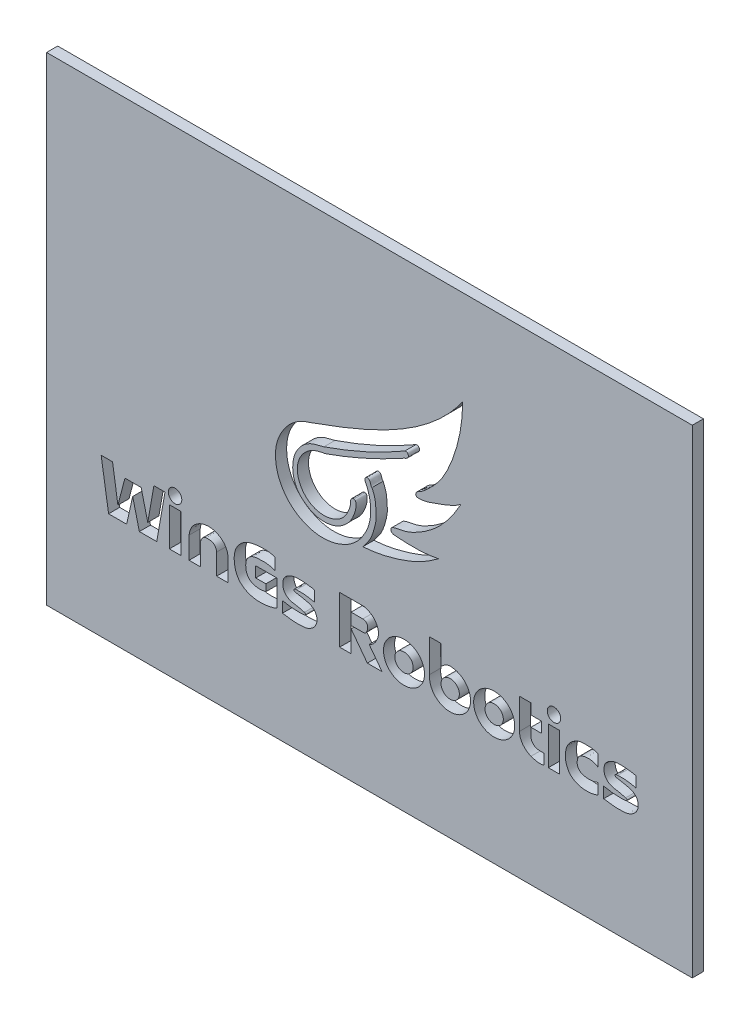
from build123d import *

# Parameters (mm, degrees)
SKETCH1_W           = 116
SKETCH1_H           = 86
BOSS_EXTRUDE1_DEPTH = 2
SKETCH2_W           = 2.050080953
SKETCH2_H           = 6.874434124
SKETCH2_W_2         = 1.981029746
SKETCH2_H_2         = 6.809423223
SKETCH2_R           = 1.213859124
SKETCH2_R_2         = 1.204225855
CUT_EXTRUDE1_DEPTH  = 11


with BuildPart() as part:
    # Sketch1 → Boss-Extrude1 (new body)
    with BuildSketch(Plane.XY):
        with Locations((58, 43)):
            Rectangle(SKETCH1_W, SKETCH1_H)
    extrude(amount=BOSS_EXTRUDE1_DEPTH)

    # Sketch2 → Cut-Extrude1 (cut)
    # profile 1 of 16: a face of its own
    with BuildSketch(Plane.XY.offset(2)):
        Polygon((11.852733183, 28.23498876), (9.80265223, 28.23498876), (11.140293702, 19.790279863), (14.382620316, 19.790279863), (15.467765439, 24.653578889), (16.665334568, 19.790279863), (19.785291617, 19.790279863), (21.274381817, 28.23498876), (19.282459189, 28.23498876), (18.177451016, 21.968429251), (16.985205355, 26.810109799), (14.07728911, 26.810109799), (12.812345543, 21.968429251), align=None)
    # profile 2 of 16: a face of its own
    with BuildSketch(Plane.XY.offset(2)):
        with Locations((23.08455968, 23.227496925)):
            Rectangle(SKETCH2_W, SKETCH2_H)
    # profile 3 of 16: a face of its own
    with BuildSketch(Plane.XY.offset(2)):
        with BuildLine():
            Line((32.593329118, 19.790279863), (32.593329118, 23.698574699))
            add(Edge.make_bspline(
                [(25.597182949, 23.698574699), (25.655024383, 24.365774688), (26.094095564, 25.511687071), (27.542408981, 26.573688518), (30.276837479, 27.206654041), (32.573603491, 25.561936036), (32.593329118, 23.698574699)],
                knots=[0, 0, 0, 0, 0.198571456, 0.340640158, 0.513500481, 1, 1, 1, 1], degree=3))
            Line((25.597182949, 23.698574699), (25.597182949, 19.790279863))
            Line((25.597182949, 19.790279863), (27.642687936, 19.790279863))
            Line((27.642687936, 19.790279863), (27.642687936, 23.53425261))
            add(Edge.make_bspline(
                [(30.550507488, 23.53425261), (30.543410322, 23.975896739), (30.106824896, 24.716492763), (29.076011424, 24.858477486), (28.007386667, 24.772266409), (27.672864704, 23.933055449), (27.642687936, 23.53425261)],
                knots=[0, 0, 0, 0, 0.311205264, 0.495487823, 0.702071237, 1, 1, 1, 1], degree=3))
            Line((30.550507488, 23.53425261), (30.550507488, 19.790279863))
            Line((30.550507488, 19.790279863), (32.593329118, 19.790279863))
        make_face()
    # profile 4 of 16: a face of its own
    with BuildSketch(Plane.XY.offset(2)):
        with BuildLine():
            add(Edge.make_bspline(
                [(41.058476828, 28.008964275), (40.053420622, 28.339513511), (38.252788176, 28.348289283), (35.579957653, 27.861823316), (33.807127389, 26.011782786), (33.590864529, 23.48949894), (34.259884703, 21.082821932), (36.595364, 19.679501372), (39.068594523, 19.5440089), (40.723497475, 19.936398387), (41.424471902, 20.231702472)],
                knots=[0, 0, 0, 0, 0.156695014, 0.267521344, 0.399378103, 0.502861963, 0.63762312, 0.747872283, 0.886034629, 1, 1, 1, 1], degree=3))
            Line((41.424471902, 20.231702472), (41.424471902, 24.925589684))
            Line((41.424471902, 24.925589684), (37.575915349, 24.925589684))
            Line((37.575915349, 24.925589684), (37.575915349, 23.026010695))
            Line((37.575915349, 23.026010695), (39.392903947, 23.026010695))
            Line((39.392903947, 23.026010695), (39.392903947, 21.787154833))
            add(Edge.make_bspline(
                [(39.392903947, 21.787154833), (38.709328807, 21.648731932), (37.576908234, 21.542273573), (36.102464246, 22.345223797), (35.704866734, 23.743461009), (35.813146547, 25.200823073), (36.969778747, 26.203973561), (38.234458734, 26.273280017), (39.623410218, 26.318179205), (40.523608068, 26.087789356), (41.058476828, 25.902909309)],
                knots=[0, 0, 0, 0, 0.18146663, 0.284134985, 0.402884015, 0.534993454, 0.639880998, 0.765013074, 0.852735118, 1, 1, 1, 1], degree=3))
            Line((41.058476828, 25.902909309), (41.058476828, 28.008964275))
        make_face()
    # profile 5 of 16: a face of its own
    with BuildSketch(Plane.XY.offset(2)):
        with BuildLine():
            Line((42.372568114, 21.90410986), (42.372568114, 19.942636104))
            add(Edge.make_bspline(
                [(44.806139371, 24.345586206), (45.423564394, 24.273968664), (46.288006885, 24.064813555), (47.46290877, 23.806737598), (48.147012509, 23.319049527), (48.545595153, 22.590177306), (48.619598313, 21.763304801), (48.319682406, 20.806370209), (47.572161935, 20.139557196), (46.608821821, 19.710816999), (45.568962771, 19.681190723), (44.121341532, 19.640413074), (43.061307266, 19.870150262), (42.372568114, 19.942636104)],
                knots=[0, 0, 0, 0, 0.150365809, 0.21715787, 0.290606041, 0.346071454, 0.414260527, 0.486930119, 0.581715223, 0.647372918, 0.740088904, 0.830726665, 1, 1, 1, 1], degree=3))
            add(Edge.make_bspline(
                [(44.51078328, 24.752820598), (44.406308103, 24.717681376), (44.387924492, 24.412408384), (44.702186936, 24.383832223), (44.806139371, 24.345586206)],
                knots=[0, 0, 0, 0, 0.400794389, 1, 1, 1, 1], degree=3))
            add(Edge.make_bspline(
                [(44.888792958, 24.852708279), (44.689182117, 24.848786999), (44.51078328, 24.752820598)],
                knots=[0, 0, 0, 1, 1, 1], degree=2))
            add(Edge.make_bspline(
                [(48.148216766, 24.517425483), (46.54397318, 24.945679792), (44.888792958, 24.852708279)],
                knots=[0, 0, 0, 1, 1, 1], degree=2))
            Line((48.148216766, 24.517425483), (48.148216766, 26.428077311))
            add(Edge.make_bspline(
                [(46.317322138, 22.049037935), (45.824731993, 22.210742689), (44.975778867, 22.40163227), (43.648132153, 22.55699702), (42.701652483, 23.251908996), (42.420499941, 24.163498462), (42.431107022, 24.854255388), (42.572538443, 25.490668332), (43.004076818, 26.004420138), (43.507908782, 26.358764483), (44.109433868, 26.601004045), (44.74426891, 26.734288086), (45.445562789, 26.743327695), (46.262343534, 26.742582693), (47.164011558, 26.592971419), (47.832474332, 26.519558956), (48.148216766, 26.428077311)],
                knots=[0, 0, 0, 0, 0.129354314, 0.216840147, 0.332807427, 0.395281765, 0.447955501, 0.504878839, 0.55358992, 0.611567985, 0.657300196, 0.714661081, 0.77238727, 0.832100329, 0.918345636, 1, 1, 1, 1], degree=3))
            add(Edge.make_bspline(
                [(42.372568114, 21.90410986), (42.852483981, 21.803658023), (43.540520525, 21.684742464), (44.478218307, 21.597026122), (45.194509725, 21.588266366), (45.868754908, 21.582787144), (46.30052186, 21.631307616), (46.529651689, 21.687660928), (46.556676317, 21.797012759), (46.552265055, 21.96425316), (46.37902786, 22.020999474), (46.317322138, 22.049037935)],
                knots=[0, 0, 0, 0, 0.315552381, 0.449832635, 0.605449321, 0.778844328, 0.876434538, 0.897820479, 0.917220083, 0.942476197, 1, 1, 1, 1], degree=3))
        make_face()
    # profile 6 of 16: a face of its own
    with BuildSketch(Plane.XY.offset(2)):
        with BuildLine():
            Line((60.268122243, 19.79950217), (57.950903995, 22.876918969))
            add(Edge.make_bspline(
                [(56.993288194, 28.316464094), (57.507888583, 28.199947411), (58.406020002, 27.861332004), (59.304855599, 26.802490907), (59.764827962, 25.5392533), (59.345117638, 23.970677964), (58.578129601, 23.113462352), (57.950903995, 22.876918969)],
                knots=[0, 0, 0, 0, 0.21664701, 0.372499043, 0.551296922, 0.738033031, 1, 1, 1, 1], degree=3))
            Line((56.993288194, 28.316464094), (52.650010924, 28.316464094))
            Line((52.650010924, 28.316464094), (52.650010924, 19.79950217))
            Line((52.650010924, 19.79950217), (54.699102304, 19.79950217))
            Line((54.699102304, 19.79950217), (54.699102304, 23.683102457))
            Line((54.699102304, 23.683102457), (57.623356652, 19.79950217))
            Line((57.623356652, 19.79950217), (60.268122243, 19.79950217))
        make_face()
        with BuildLine():
            Line((54.699102304, 26.274566068), (56.811430016, 26.274566068))
            add(Edge.make_bspline(
                [(56.811430016, 26.274566068), (57.165142546, 26.312013915), (57.762696052, 25.857331641), (57.662984423, 24.819667856), (57.332468607, 24.193202864), (56.894826652, 24.204529659)],
                knots=[0, 0, 0, 0, 0.345185418, 0.626260613, 1, 1, 1, 1], degree=3))
            Line((56.894826652, 24.204529659), (54.699102304, 24.204529659))
            Line((54.699102304, 24.204529659), (54.699102304, 26.274566068))
        make_face(mode=Mode.SUBTRACT)
    # profile 7 of 16: a face of its own
    with BuildSketch(Plane.XY.offset(2)):
        with BuildLine():
            Line((70.875700117, 29.486042678), (68.793403111, 29.486042678))
            Line((68.793403111, 29.486042678), (68.819382849, 23.63112519))
            add(Edge.make_bspline(
                [(68.819382849, 23.63112519), (68.655909571, 22.307345374), (69.133176794, 19.847694152), (71.555123644, 18.628765547), (73.913456034, 19.661303089), (75.958694453, 21.428786384), (77.249289658, 23.519409778), (76.356923212, 25.969682895), (73.909976939, 26.751395584), (72.510425794, 26.768759222), (72.495262159, 26.76887153), (72.480151116, 26.768908422), (72.46509309, 26.768870944), (72.450088475, 26.768760138)],
                knots=[6.176447512, 6.176447512, 6.176447512, 6.176447512, 6.176447512, 6.176447512, 8.596254133, 8.596254133, 8.596254133, 8.596254133, 10.989752867, 10.989752867, 10.989752867, 10.989752867, 11.016060754, 11.016060754, 11.016060754, 11.016060754, 11.016060754, 11.016060754], degree=5, weights=[1, 1, 0.832613261, 0.832613261, 1, 1, 0.839849545, 0.835296689, 1, 1, 1.000000003, 1.000000003, 1, 1]))
            add(Edge.make_bspline(
                [(70.875700117, 25.957189376), (71.166477188, 26.20926662), (71.655724283, 26.56346003), (72.234921297, 26.761658442), (72.450088475, 26.768760138)],
                knots=[0, 0, 0, 0, 0.616176335, 0.959930277, 0.959930277, 0.959930277, 0.959930277], degree=3))
            Line((70.875700117, 25.957189376), (70.875700117, 29.486042678))
        make_face()
        with BuildLine():
            add(Edge.make_bspline(
                [(70.875700117, 23.037387122), (71.211642535, 20.263073147), (73.493414254, 21.946870158), (75.775185973, 23.630667169), (73.157471836, 24.721184133), (70.539757699, 25.811701097), (70.875700117, 23.037387122)],
                knots=[0, 0, 0, 2.094395102, 2.094395102, 4.188790205, 4.188790205, 6.283185307, 6.283185307, 6.283185307], degree=2, weights=[1, 0.5, 1, 0.5, 1, 0.5, 1]))
        make_face(mode=Mode.SUBTRACT)
    # profile 8 of 16: a face of its own
    with BuildSketch(Plane.XY.offset(2)):
        with BuildLine():
            Line((87.019259344, 28.316464094), (84.974819681, 28.316464094))
            Line((84.974819681, 28.316464094), (84.974819681, 22.876918969))
            add(Edge.make_bspline(
                [(84.974819681, 22.876918969), (84.904874023, 21.581617108), (85.880370875, 20.470748303), (87.019259344, 20.009497646)],
                knots=[0, 0, 0, 0, 1, 1, 1, 1], degree=3))
            add(Edge.make_bspline(
                [(87.019259344, 20.009497646), (87.764844995, 19.766104306), (88.592472755, 19.517741572), (89.369700044, 19.790279863)],
                knots=[0, 0, 0, 0, 1, 1, 1, 1], degree=3))
            Line((89.369700044, 19.790279863), (89.369700044, 21.656437237))
            add(Edge.make_bspline(
                [(89.369700044, 21.656437237), (88.886440556, 21.681452245), (88.103178845, 21.552378339), (87.281716916, 22.165179144), (87.087153612, 22.617862686), (87.019259344, 22.876918969)],
                knots=[0, 0, 0, 0, 0.514659913, 0.724878499, 1, 1, 1, 1], degree=3))
            Line((87.019259344, 22.876918969), (87.019259344, 24.517425483))
            Line((87.019259344, 24.517425483), (88.927403029, 24.517425483))
            Line((88.927403029, 24.517425483), (88.927403029, 26.428077311))
            Line((88.927403029, 26.428077311), (87.019259344, 26.428077311))
            Line((87.019259344, 26.428077311), (87.019259344, 28.316464094))
        make_face()
    # profile 9 of 16: a face of its own
    with BuildSketch(Plane.XY.offset(2)):
        with Locations((91.132775555, 23.194991475)):
            Rectangle(SKETCH2_W_2, SKETCH2_H_2)
    # profile 10 of 16: a face of its own
    with BuildSketch(Plane.XY.offset(2)):
        with BuildLine():
            Line((100.081666186, 21.89670404), (100.081666186, 19.935230284))
            add(Edge.make_bspline(
                [(102.515237443, 24.338180385), (103.132662467, 24.266562843), (103.997104957, 24.057407734), (105.172006842, 23.799331777), (105.856110582, 23.311643706), (106.254693225, 22.582771485), (106.328696385, 21.75589898), (106.028780479, 20.798964389), (105.281260008, 20.132151375), (104.317919893, 19.703411179), (103.278060843, 19.673784902), (101.830439604, 19.633007253), (100.770405338, 19.862744441), (100.081666186, 19.935230284)],
                knots=[0, 0, 0, 0, 0.150365809, 0.21715787, 0.290606041, 0.346071454, 0.414260527, 0.486930119, 0.581715223, 0.647372918, 0.740088904, 0.830726665, 1, 1, 1, 1], degree=3))
            add(Edge.make_bspline(
                [(102.219881352, 24.745414777), (102.115406175, 24.710275556), (102.097022564, 24.405002563), (102.411285008, 24.376426403), (102.515237443, 24.338180385)],
                knots=[0, 0, 0, 0, 0.400794389, 1, 1, 1, 1], degree=3))
            add(Edge.make_bspline(
                [(102.59789103, 24.845302458), (102.398280189, 24.841381178), (102.219881352, 24.745414777)],
                knots=[0, 0, 0, 1, 1, 1], degree=2))
            add(Edge.make_bspline(
                [(105.857314838, 24.510019662), (104.253071252, 24.938273972), (102.59789103, 24.845302458)],
                knots=[0, 0, 0, 1, 1, 1], degree=2))
            Line((105.857314838, 24.510019662), (105.857314838, 26.420671491))
            add(Edge.make_bspline(
                [(104.02642021, 22.041632114), (103.533830066, 22.203336869), (102.68487694, 22.394226449), (101.357230225, 22.5495912), (100.410750556, 23.244503176), (100.129598013, 24.156092641), (100.140205094, 24.846849567), (100.281636516, 25.483262512), (100.71317489, 25.997014317), (101.217006854, 26.351358662), (101.81853194, 26.593598224), (102.453366982, 26.726882265), (103.154660861, 26.735921874), (103.971441607, 26.735176872), (104.87310963, 26.585565598), (105.541572404, 26.512153135), (105.857314838, 26.420671491)],
                knots=[0, 0, 0, 0, 0.129354314, 0.216840147, 0.332807427, 0.395281765, 0.447955501, 0.504878839, 0.55358992, 0.611567985, 0.657300196, 0.714661081, 0.77238727, 0.832100329, 0.918345636, 1, 1, 1, 1], degree=3))
            add(Edge.make_bspline(
                [(100.081666186, 21.89670404), (100.561582053, 21.796252202), (101.249618597, 21.677336643), (102.18731638, 21.589620301), (102.903607798, 21.580860546), (103.57785298, 21.575381323), (104.009619933, 21.623901795), (104.238749761, 21.680255107), (104.265774389, 21.789606938), (104.261363127, 21.95684734), (104.088125932, 22.013593653), (104.02642021, 22.041632114)],
                knots=[0, 0, 0, 0, 0.315552381, 0.449832635, 0.605449321, 0.778844328, 0.876434538, 0.897820479, 0.917220083, 0.942476197, 1, 1, 1, 1], degree=3))
        make_face()
    # profile 11 of 16: a face of its own
    with BuildSketch(Plane.XY.offset(2)):
        with Locations((23.077289889, 28.540319965)):
            Circle(SKETCH2_R)
    # profile 12 of 16: a face of its own
    with BuildSketch(Plane.XY.offset(2)):
        with Locations((91.149003897, 28.540319965)):
            Circle(SKETCH2_R_2)
    # profile 13 of 16: a face of its own
    with BuildSketch(Plane.XY.offset(2)):
        with BuildLine():
            add(Edge.make_bspline(
                [(60.520652519, 23.223770711), (60.520652519, 17.012049197), (66.052713203, 20.117909954), (71.584773886, 23.223770711), (66.052713203, 26.329631468), (60.520652519, 29.435492225), (60.520652519, 23.223770711)],
                knots=[0, 0, 0, 2.094395102, 2.094395102, 4.188790205, 4.188790205, 6.283185307, 6.283185307, 6.283185307], degree=2, weights=[1, 0.5, 1, 0.5, 1, 0.5, 1]))
        make_face()
        with BuildLine():
            add(Edge.make_bspline(
                [(62.575531023, 23.026010695), (62.911473441, 20.251696721), (65.19324516, 21.935493732), (67.475016879, 23.619290743), (64.857302742, 24.709807706), (62.239588605, 25.80032467), (62.575531023, 23.026010695)],
                knots=[0, 0, 0, 2.094395102, 2.094395102, 4.188790205, 4.188790205, 6.283185307, 6.283185307, 6.283185307], degree=2, weights=[1, 0.5, 1, 0.5, 1, 0.5, 1]))
        make_face(mode=Mode.SUBTRACT)
    # profile 14 of 16: a face of its own
    with BuildSketch(Plane.XY.offset(2)):
        with BuildLine():
            add(Edge.make_bspline(
                [(76.723043602, 23.258188157), (76.723043602, 17.046466643), (82.255104285, 20.1523274), (87.787164969, 23.258188157), (82.255104285, 26.364048914), (76.723043602, 29.469909671), (76.723043602, 23.258188157)],
                knots=[0, 0, 0, 2.094395102, 2.094395102, 4.188790205, 4.188790205, 6.283185307, 6.283185307, 6.283185307], degree=2, weights=[1, 0.5, 1, 0.5, 1, 0.5, 1]))
        make_face()
        with BuildLine():
            add(Edge.make_bspline(
                [(78.777922105, 23.060428141), (79.113864523, 20.286114166), (81.395636242, 21.969911177), (83.677407961, 23.653708188), (81.059693824, 24.744225152), (78.441979687, 25.834742116), (78.777922105, 23.060428141)],
                knots=[0, 0, 0, 2.094395102, 2.094395102, 4.188790205, 4.188790205, 6.283185307, 6.283185307, 6.283185307], degree=2, weights=[1, 0.5, 1, 0.5, 1, 0.5, 1]))
        make_face(mode=Mode.SUBTRACT)
    # profile 15 of 16: a face of its own
    with BuildSketch(Plane.XY.offset(2)):
        with BuildLine():
            add(Edge.make_bspline(
                [(47.183080217, 52.026795225), (57.216006345, 55.660419078), (68.349060224, 59.914176828), (74.752380083, 69.037208456)],
                knots=[0, 0, 0, 0, 1, 1, 1, 1], degree=3))
            add(Edge.make_bspline(
                [(58.454232807, 47.516375152), (58.155201107, 47.766256761), (58.242612626, 48.405648514), (57.63435824, 48.725818852), (57.33951575, 48.561080563), (57.148056352, 48.331669293), (57.191833565, 47.968880637), (57.373109598, 47.594828313), (57.64633552, 47.047787141), (57.835821816, 46.438243828), (58.054855682, 45.66789616), (58.183227128, 44.904585404), (58.245836004, 43.851782874), (58.214820236, 42.740629424), (57.93171993, 41.583185887), (57.630830141, 40.625252894), (57.159571505, 39.759385244), (56.516222929, 38.60157538), (55.42470024, 37.436336943), (54.116750982, 36.463653396), (52.894350187, 35.923293203), (51.77243295, 35.514319825), (50.450751358, 35.31741506), (48.783731824, 35.237164884), (46.898690964, 35.69687239), (44.924093636, 36.617380122), (43.161708961, 38.106675964), (42.003804738, 39.901498444), (41.341001552, 41.702039563), (41.031458158, 43.795886426), (41.241639988, 46.031174435), (42.353202792, 48.424037338), (44.089054597, 50.650061335), (46.063860923, 51.731417101), (47.183080217, 52.026795225)],
                knots=[0, 0, 0, 0, 0.025484439, 0.03338283, 0.040232234, 0.046589479, 0.052344178, 0.063458754, 0.074883627, 0.093534169, 0.106469828, 0.129018368, 0.145624842, 0.177759685, 0.20359143, 0.225939601, 0.245354605, 0.270053463, 0.315285484, 0.351906237, 0.379454707, 0.405318365, 0.432327032, 0.469428533, 0.517419701, 0.561659463, 0.615846213, 0.670886596, 0.70401842, 0.744828345, 0.813276794, 0.851640065, 0.922150279, 1, 1, 1, 1], degree=3))
            add(Edge.make_bspline(
                [(56.811430016, 37.503961117), (57.150102419, 38.014022677), (57.987255556, 38.904490686), (58.613227549, 40.422973363), (59.012652401, 41.840922862), (59.290272897, 43.220897632), (59.160816631, 44.408188822), (59.11246086, 45.885792368), (58.773408264, 46.827837511), (58.454232807, 47.516375152)],
                knots=[0, 0, 0, 0, 0.1719112, 0.337536146, 0.453261138, 0.586013532, 0.727876697, 0.785410912, 1, 1, 1, 1], degree=3))
            add(Edge.make_bspline(
                [(70.410675427, 42.422660643), (69.072158185, 41.392849447), (66.673523302, 39.95664783), (63.113718316, 38.677885822), (60.018889064, 37.859420378), (57.920946683, 37.5757846), (56.811430016, 37.503961117)],
                knots=[0, 0, 0, 0, 0.345508658, 0.567873889, 0.772356782, 1, 1, 1, 1], degree=3))
            add(Edge.make_bspline(
                [(62.575531023, 42.134455593), (63.354690243, 42.053803072), (64.7000675, 41.991387353), (66.708351282, 41.980958204), (68.546303226, 42.102590199), (69.809212082, 42.294223653), (70.410675427, 42.422660643)],
                knots=[0, 0, 0, 0, 0.298501271, 0.513417608, 0.765547662, 1, 1, 1, 1], degree=3))
            add(Edge.make_bspline(
                [(74.434250991, 52.903399761), (73.534437389, 51.244569181), (71.936292943, 48.870628445), (69.171720948, 46.226278325), (66.812856972, 44.685192365), (64.459018347, 43.563749511), (62.770947443, 43.441981971), (61.838513719, 43.010318867), (61.79284973, 42.33300121), (62.305978307, 42.117953901), (62.575531023, 42.134455593)],
                knots=[0, 0, 0, 0, 0.317486122, 0.477470025, 0.639062499, 0.792072541, 0.904921088, 0.928219039, 0.952009601, 1, 1, 1, 1], degree=3))
            add(Edge.make_bspline(
                [(74.752380083, 69.037208456), (74.736480386, 65.365885816), (73.727785029, 60.42570916), (70.966298428, 54.814242003), (68.758137434, 52.543762288), (67.300781423, 51.259360355), (66.385730313, 50.889179194), (66.191919274, 50.032187732), (67.340500179, 50.051911847), (68.580710142, 50.28254762), (71.142874018, 51.242375338), (73.213453076, 51.977233393), (74.434250991, 52.903399761)],
                knots=[0, 0, 0, 0, 0.360634108, 0.500005098, 0.614901621, 0.674581887, 0.691796307, 0.711226794, 0.738155757, 0.775635724, 0.851125952, 1, 1, 1, 1], degree=3))
        make_face()
        with BuildLine():
            add(Edge.make_bspline(
                [(64.349924674, 56.161374818), (57.438497294, 52.157653387), (49.814342424, 49.548665095)],
                knots=[0, 0, 0, 1, 1, 1], degree=2))
            add(Edge.make_bspline(
                [(64.349924674, 56.161374818), (64.469308928, 56.198038689), (64.738228566, 56.247793356), (64.929809958, 55.987135025), (65.02677974, 55.728006959), (64.891079963, 55.148714005), (64.273965083, 55.054702659), (64.038603905, 54.882342772)],
                knots=[0, 0, 0, 0, 0.180534732, 0.288784375, 0.393192125, 0.542413532, 1, 1, 1, 1], degree=3))
            add(Edge.make_bspline(
                [(64.038603905, 54.882342772), (59.572034383, 52.406223373), (54.900103059, 50.294759316), (50.074487372, 48.612115737)],
                knots=[0, 0, 0, 0, 1, 1, 1, 1], degree=3))
            add(Edge.make_bspline(
                [(55.208034601, 44.116133089), (55.022625143, 44.179137333), (54.667036382, 43.958988589), (54.609396177, 43.464246826), (54.597765617, 42.863626491), (54.34232087, 42.009327553), (53.776372018, 40.734234474), (52.329674774, 39.33758596), (50.15244427, 38.721390022), (47.705197676, 39.133153699), (45.93028533, 40.62158031), (44.977495317, 42.793991738), (45.042833315, 45.537264714), (47.124443032, 48.008216113), (49.205962332, 48.468704925), (50.074487372, 48.612115737)],
                knots=[0, 0, 0, 0, 0.023492855, 0.044042325, 0.061062078, 0.101136052, 0.156797186, 0.239209866, 0.350065975, 0.433770548, 0.549578037, 0.629423488, 0.732521354, 0.886290578, 1, 1, 1, 1], degree=3))
            add(Edge.make_bspline(
                [(49.814342424, 49.548665095), (49.164290041, 49.378401155), (48.212436546, 49.196059818), (46.372347391, 48.377280304), (44.219210093, 46.16100786), (43.977382754, 42.604306322), (45.225353462, 40.052494882), (46.595117348, 38.914609571), (48.298977569, 37.990831076), (50.179012631, 37.837873079), (52.012731798, 38.232040281), (53.395544621, 39.100170897), (54.501661681, 40.189216921), (55.187854158, 41.482764429), (55.562081954, 42.679754198), (55.631497641, 43.576813671), (55.453855705, 44.128916533), (55.208034601, 44.116133089)],
                knots=[0, 0, 0, 0, 0.074166524, 0.105399841, 0.22059516, 0.394008221, 0.454413258, 0.527731026, 0.585288596, 0.665338457, 0.728527594, 0.788515133, 0.842168303, 0.897127647, 0.948286442, 0.97672011, 1, 1, 1, 1], degree=3))
        make_face(mode=Mode.SUBTRACT)
    # profile 16 of 16: a face of its own
    with BuildSketch(Plane.XY.offset(2)):
        with BuildLine():
            Line((99.045082433, 24.345586206), (99.107363386, 26.428077311))
            add(Edge.make_bspline(
                [(99.107363386, 26.428077311), (98.706813514, 26.570619476), (98.057086859, 26.739047265), (97.144064108, 26.769744551), (96.425929948, 26.789005977), (95.6235266, 26.680118298), (94.766663587, 26.291049934), (94.018726516, 25.642257941), (93.394133402, 24.752120489), (93.19884016, 23.708895909), (93.18851624, 22.662055822), (93.450358204, 21.640092766), (94.692233145, 19.432342362), (97.670513165, 19.369727476), (99.076222909, 20.009497646)],
                knots=[0, 0, 0, 0, 0.080031766, 0.124597918, 0.17129882, 0.21488749, 0.275500126, 0.344981473, 0.39882164, 0.47645066, 0.539473476, 0.594476939, 0.673244535, 1, 1, 1, 1], degree=3))
            Line((99.076222909, 20.009497646), (99.045082433, 21.968429251))
            add(Edge.make_bspline(
                [(95.962175283, 24.517425483), (95.590503523, 24.35964368), (95.371380246, 23.80674187), (95.284997638, 23.024137326), (95.465768646, 22.395754832), (95.907523378, 21.960247649), (96.471324165, 21.728931484), (97.52614725, 21.584707283), (98.434101144, 21.657237599), (99.045082433, 21.968429251)],
                knots=[0, 0, 0, 0, 0.178931515, 0.272004473, 0.383258516, 0.483726003, 0.563109197, 0.676720983, 1, 1, 1, 1], degree=3))
            add(Edge.make_bspline(
                [(99.045082433, 24.345586206), (98.140817478, 24.917670358), (96.933385238, 25.010368916), (95.962175283, 24.517425483)],
                knots=[0, 0, 0, 0, 1, 1, 1, 1], degree=3))
        make_face()
    extrude(amount=-CUT_EXTRUDE1_DEPTH, mode=Mode.SUBTRACT)


with BuildPart() as cut_extrude1_piece_1:
    # of the separate pieces the step leaves, piece 1, a body of its own (cut_extrude1_pieces)
    add(part.part.solids().sort_by_distance((0, 0, 0))[0])


with BuildPart() as cut_extrude1_piece_2:
    # of the separate pieces the step leaves, piece 2, a body of its own (cut_extrude1_pieces)
    add(part.part.solids().sort_by_distance((50.074487372, 48.612115737, 0))[0])


with BuildPart() as cut_extrude1_piece_3:
    # of the separate pieces the step leaves, piece 3, a body of its own (cut_extrude1_pieces)
    add(part.part.solids().sort_by_distance((62.575531023, 23.026010695, 0))[0])


with BuildPart() as cut_extrude1_piece_4:
    # of the separate pieces the step leaves, piece 4, a body of its own (cut_extrude1_pieces)
    add(part.part.solids().sort_by_distance((78.777922105, 23.060428141, 0))[0])


with BuildPart() as cut_extrude1_piece_5:
    # of the separate pieces the step leaves, piece 5, a body of its own (cut_extrude1_pieces)
    add(part.part.solids().sort_by_distance((70.875700117, 23.037387122, 0))[0])


with BuildPart() as cut_extrude1_piece_6:
    # of the separate pieces the step leaves, piece 6, a body of its own (cut_extrude1_pieces)
    add(part.part.solids().sort_by_distance((54.699102304, 26.274566068, 0))[0])


solid = Compound([cut_extrude1_piece_1.part, cut_extrude1_piece_2.part, cut_extrude1_piece_3.part, cut_extrude1_piece_4.part, cut_extrude1_piece_5.part, cut_extrude1_piece_6.part])
